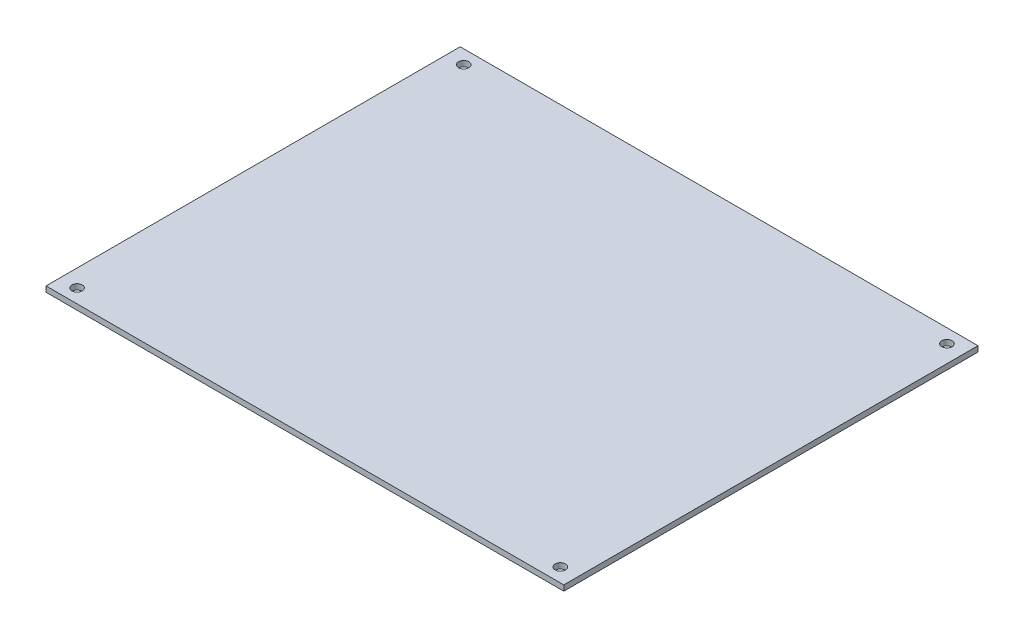
from build123d import *

# Parameters (mm, degrees)
SKETCH1_W           = 150
SKETCH1_H           = 120
SKETCH1_R           = 1.5
BOSS_EXTRUDE1_DEPTH = 1.6


with BuildPart() as part:
    # Sketch1 → Boss-Extrude1 (new body)
    with BuildSketch(Plane(origin=(0, 0, 0), x_dir=(1, 0, 0), z_dir=(0, 1, 0))):
        Rectangle(SKETCH1_W, SKETCH1_H)
        with Locations((70, 56)):
            Circle(SKETCH1_R, mode=Mode.SUBTRACT)
        with Locations((70, -56)):
            Circle(SKETCH1_R, mode=Mode.SUBTRACT)
        with Locations((-70, -56)):
            Circle(SKETCH1_R, mode=Mode.SUBTRACT)
        with Locations((-70, 56)):
            Circle(SKETCH1_R, mode=Mode.SUBTRACT)
    extrude(amount=BOSS_EXTRUDE1_DEPTH)


solid = part.part
